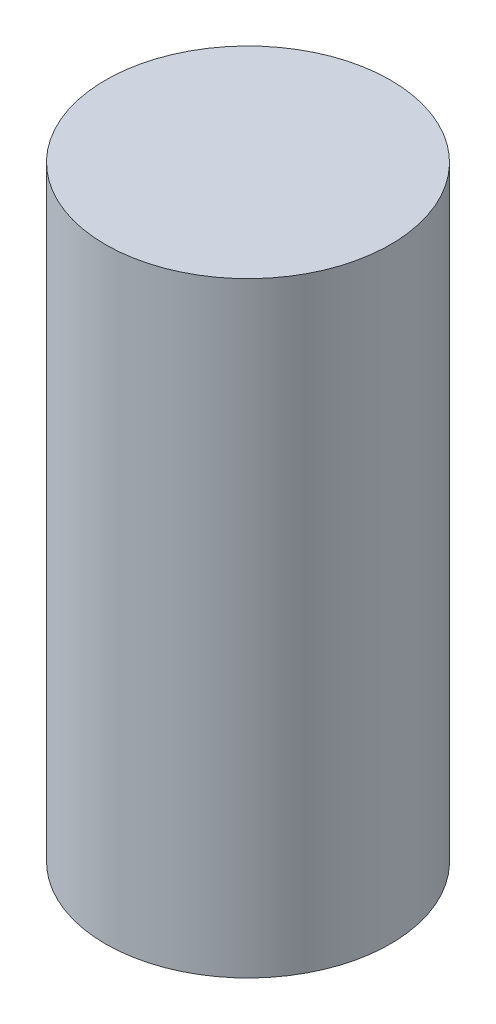
from build123d import *

# Parameters (mm, degrees)
SKETCH1_R           = 1
BOSS_EXTRUDE1_DEPTH = 4.25


with BuildPart() as part:
    # Sketch1 → Boss-Extrude1 (new body)
    with BuildSketch(Plane(origin=(0, 0, 0), x_dir=(1, 0, 0), z_dir=(0, 1, 0))):
        Circle(SKETCH1_R)
    extrude(amount=BOSS_EXTRUDE1_DEPTH)


solid = part.part
